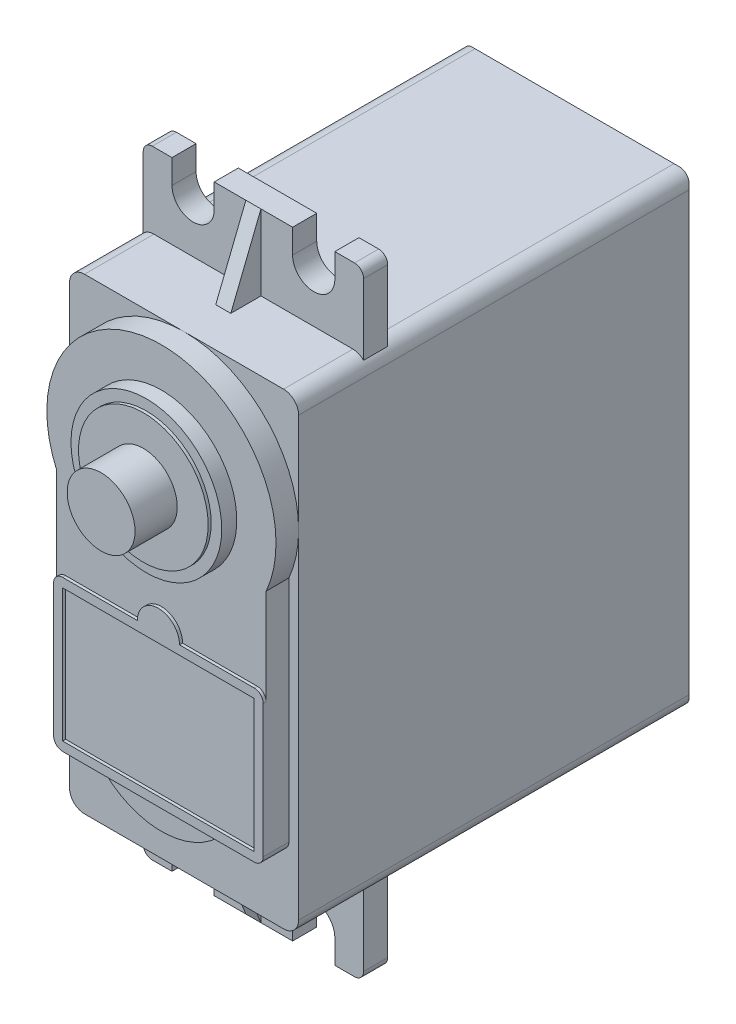
from build123d import *

# Parameters (mm, degrees)
SKETCH1_W            = 35.433
SKETCH1_H            = 39.37
BOSS_EXTRUDE1_DEPTH  = 9.652
BOSS_EXTRUDE2_DEPTH  = 1.905
SKETCH3_R            = 6.35
BOSS_EXTRUDE3_DEPTH  = 1.27
SKETCH4_R            = 5.461
BOSS_EXTRUDE4_DEPTH  = 0.254
SKETCH6_R            = 2.8575
BOSS_EXTRUDE5_DEPTH  = 3.556
FILLET1_R            = 0.762
BOSS_EXTRUDE6_START  = 0.254
SKETCH7_W            = 16.129
SKETCH7_H            = 11.176
BOSS_EXTRUDE6_DEPTH  = 0.254
CHAMFER1_SIZE        = 2.54
FILLET3_R            = 1.27
FILLET4_R            = 1.27
CUT_EXTRUDE1_DEPTH   = 2.032
MIRROR2_COPY_1_DEPTH = 2.032
BOSS_EXTRUDE7_DEPTH  = 2.032
BOSS_EXTRUDE8_DEPTH  = 0.635


with BuildPart() as part:
    # Sketch1 → Boss-Extrude1 (new, symmetric)
    with BuildSketch(Plane(origin=(0, 0, 0), x_dir=(0, 0, -1), z_dir=(1, 0, 0))):
        Rectangle(SKETCH1_W, SKETCH1_H)
    extrude(amount=BOSS_EXTRUDE1_DEPTH, both=True)

    # Sketch2 → Boss-Extrude2 (add)
    with BuildSketch(Plane.XY.offset(17.7165)):
        with BuildLine():
            Line((-8.8265, 6.127362824), (-8.8265, -13.8938))
            Line((-8.8265, -13.8938), (-4.7625, -13.8938))
            ThreePointArc((-4.7625, -13.8938), (0, -15.817151304), (4.7625, -13.8938))
            Line((4.7625, -13.8938), (8.8265, -13.8938))
            Line((8.8265, -13.8938), (8.8265, 6.127362824))
            ThreePointArc((8.8265, 6.127362824), (0, 19.685), (-8.8265, 6.127362824))
        make_face()
    extrude(amount=BOSS_EXTRUDE2_DEPTH)

    # Sketch3 → Boss-Extrude3 (add)
    with BuildSketch(Plane.XY.offset(19.6215)):
        with Locations(Location((0, 10.033, 0), (0, 0, 180))):
            Circle(SKETCH3_R)
    extrude(amount=BOSS_EXTRUDE3_DEPTH)

    # Sketch4 → Boss-Extrude4 (add)
    with BuildSketch(Plane.XY.offset(20.8915)):
        with Locations((0, 10.033)):
            Circle(SKETCH4_R)
    extrude(amount=BOSS_EXTRUDE4_DEPTH)

    # Sketch6 → Boss-Extrude5 (add)
    with BuildSketch(Plane.XY.offset(21.1455)):
        with Locations((0, 10.033)):
            Circle(SKETCH6_R)
    extrude(amount=BOSS_EXTRUDE5_DEPTH)

    # Fillet1
    fillet1_edges = [part.edges().sort_by_distance(p)[0] for p in [
        (-8.8265, -13.8938, 18.669),
        (8.8265, -13.8938, 18.669),
    ]]
    fillet(fillet1_edges, radius=FILLET1_R)

    # Sketch7 → Boss-Extrude6 (add)
    with BuildSketch(Plane.XY.offset(19.6215).offset(BOSS_EXTRUDE6_START)):
        with BuildLine():
            Line((8.8265, -13.1318), (8.8265, -1.9558))
            ThreePointArc((8.8265, -1.9558), (8.603315367, -1.416984633), (8.0645, -1.1938))
            Line((8.0645, -1.1938), (1.778, -1.1938))
            ThreePointArc((1.778, -1.1938), (0, 0.5842), (-1.778, -1.1938))
            Line((-1.778, -1.1938), (-8.0645, -1.1938))
            ThreePointArc((-8.0645, -1.1938), (-8.603315367, -1.416984633), (-8.8265, -1.9558))
            Line((-8.8265, -1.9558), (-8.8265, -13.1318))
            ThreePointArc((-8.8265, -13.1318), (-8.603315367, -13.670615367), (-8.0645, -13.8938))
            Line((-8.0645, -13.8938), (8.0645, -13.8938))
            ThreePointArc((8.0645, -13.8938), (8.603315367, -13.670615367), (8.8265, -13.1318))
        make_face()
        with Locations((0, -7.5438)):
            Rectangle(SKETCH7_W, SKETCH7_H, mode=Mode.SUBTRACT)
    extrude(amount=-BOSS_EXTRUDE6_DEPTH)

    # Chamfer1
    chamfer1_edges = [part.edges().sort_by_distance(p)[0] for p in [
        (9.652, 0, -17.7165),
        (-9.652, 0, -17.7165),
        (0, 19.685, -17.7165),
        (0, -19.685, -17.7165),
    ]]
    chamfer(chamfer1_edges, length=CHAMFER1_SIZE)

    # Fillet3
    # the kernel refuses this fillet: 1.27 mm, written as the material it takes off along each edge
    with BuildSketch(Plane(origin=(9.652, 19.685, -18.3515), x_dir=(0, -1, 0), z_dir=(0, 0, 1))) as fillet3_piece_1:
        with BuildLine():
            CenterArc((FILLET3_R, -FILLET3_R), FILLET3_R, 90, 90)
            Line((0, -FILLET3_R), (0, 0))
            Line((0, 0), (FILLET3_R, 0))
        make_face()
    extrude(amount=39.243, mode=Mode.SUBTRACT)
    with BuildSketch(Plane(origin=(10.710333333, 20.743333333, -14.118166667), x_dir=(0.408248290463863, -0.816496580927726, 0.408248290463863), z_dir=(-0.5773502691896258, -0.5773502691896257, -0.5773502691896257))) as fillet3_piece_2:
        with BuildLine():
            CenterArc((FILLET3_R * 0.57735026919, FILLET3_R), FILLET3_R, 210, 60)
            Line((-FILLET3_R * 0.288675134595, FILLET3_R * 0.5), (0, 0))
            Line((0, 0), (FILLET3_R * 0.57735026919, 0))
        make_face()
    extrude(amount=8.065583261, mode=Mode.SUBTRACT)

    # Fillet4
    # the kernel refuses this fillet: 1.27 mm, written as the material it takes off along each edge
    with BuildSketch(Plane(origin=(-9.652, 19.685, -18.3515), x_dir=(0, -1, 0), z_dir=(0, 0, 1))) as fillet4_piece_1:
        with BuildLine():
            CenterArc((FILLET4_R, FILLET4_R), FILLET4_R, 180, 90)
            Line((0, FILLET4_R), (0, 0))
            Line((0, 0), (FILLET4_R, 0))
        make_face()
    extrude(amount=39.243, mode=Mode.SUBTRACT)
    with BuildSketch(Plane(origin=(-6.053666667, 16.086666667, -18.774833333), x_dir=(0.816496580927726, 0.40824829046386296, 0.40824829046386296), z_dir=(-0.5773502691896257, 0.5773502691896258, 0.5773502691896258)), Plane(origin=(10.710333333, -20.743333333, -14.118166667), x_dir=(0.4082482904638618, 0.816496580927726, 0.40824829046386424), z_dir=(-0.5773502691896258, 0.5773502691896257, -0.5773502691896257))) as fillet4_piece_2:
        with BuildLine():
            CenterArc((FILLET4_R * 0.57735026919, -FILLET4_R), FILLET4_R, 90, 60)
            Line((-FILLET4_R * 0.288675134595, -FILLET4_R * 0.5), (0, 0))
            Line((0, 0), (FILLET4_R * 0.57735026919, 0))
        make_face()
    extrude(amount=8.065583261, mode=Mode.SUBTRACT)
    with BuildSketch(Plane(origin=(-6.053666667, -16.086666667, -18.774833333), x_dir=(0.8164965809277258, -0.4082482904638633, 0.4082482904638633), z_dir=(-0.5773502691896261, -0.5773502691896256, 0.5773502691896256))) as fillet4_piece_3:
        with BuildLine():
            CenterArc((FILLET4_R * 0.57735026919, FILLET4_R), FILLET4_R, 210, 60)
            Line((-FILLET4_R * 0.288675134595, FILLET4_R * 0.5), (0, 0))
            Line((0, 0), (FILLET4_R * 0.57735026919, 0))
        make_face()
    extrude(amount=8.065583261, mode=Mode.SUBTRACT)
    with BuildSketch(Plane(origin=(-9.652, -19.685, 20.8915), x_dir=(1, 0, 0), z_dir=(0, 0, -1)), Plane(origin=(9.652, -19.685, 20.8915), x_dir=(0, 1, 0), z_dir=(0, 0, -1))) as fillet4_piece_4:
        with BuildLine():
            CenterArc((FILLET4_R, -FILLET4_R), FILLET4_R, 90, 90)
            Line((0, -FILLET4_R), (0, 0))
            Line((0, 0), (FILLET4_R, 0))
        make_face()
    extrude(amount=39.243, mode=Mode.SUBTRACT)

    # Sketch9 → Cut-Extrude1 (cut)
    with BuildSketch(Plane(origin=(0, 0, -17.7165), x_dir=(-1, 0, 0), z_dir=(0, 0, -1))):
        with BuildLine():
            Line((-5.181767112, 17.145), (-5.181767112, 19.685))
            Line((-5.181767112, 19.685), (-9.652, 19.685))
            Line((-9.652, 19.685), (-9.652, 15.748))
            Line((-9.652, 15.748), (-7.112, 15.748))
            ThreePointArc((-7.112, 15.748), (-5.920634397, 16.133891863), (-5.181767112, 17.145))
        make_face()
    cut_extrude1 = extrude(amount=-CUT_EXTRUDE1_DEPTH, mode=Mode.SUBTRACT)

    # Mirror1: Cut-Extrude1 across plane
    add(cut_extrude1.mirror(Plane.ZX), mode=Mode.SUBTRACT)

    # Mirror2: Cut-Extrude1 across plane
    add(cut_extrude1.mirror(Plane(origin=(0, 0, 0), x_dir=(0, 0, 1), z_dir=(1, 0, 0))), mode=Mode.SUBTRACT)

    # Mirror2 copy 1 sketch → Mirror2 copy 1 (cut)
    with BuildSketch(Plane(origin=(0, 0, -17.7165), x_dir=(1, 0, 0), z_dir=(0, 0, -1))):
        with BuildLine():
            Line((-5.181767112, 17.145), (-5.181767112, 19.685))
            Line((-5.181767112, 19.685), (-9.652, 19.685))
            Line((-9.652, 19.685), (-9.652, 15.748))
            Line((-9.652, 15.748), (-7.112, 15.748))
            ThreePointArc((-7.112, 15.748), (-5.920634397, 16.133891863), (-5.181767112, 17.145))
        make_face()
    extrude(amount=-MIRROR2_COPY_1_DEPTH, mode=Mode.SUBTRACT)

    # Sketch13 → Boss-Extrude7 (add)
    with BuildSketch(Plane.XY.offset(11.8745)):
        with BuildLine():
            Line((-9.280025612, -19.313025612), (-9.280025612, -25.273))
            ThreePointArc((-9.280025612, -25.273), (-9.056840979, -25.811815367), (-8.518025612, -26.035))
            Line((-8.518025612, -26.035), (-6.858, -26.035))
            Line((-6.858, -26.035), (-6.858, -24))
            ThreePointArc((-6.858, -24), (-5.08, -22.222), (-3.302, -24))
            Line((-3.302, -24), (-3.302, -26.035))
            Line((-3.302, -26.035), (3.302, -26.035))
            Line((3.302, -26.035), (3.302, -24))
            ThreePointArc((3.302, -24), (5.08, -22.222), (6.858, -24))
            Line((6.858, -24), (6.858, -26.035))
            Line((6.858, -26.035), (8.518025612, -26.035))
            ThreePointArc((8.518025612, -26.035), (9.056840979, -25.811815367), (9.280025612, -25.273))
            Line((9.280025612, -25.273), (9.280025612, -19.313025612))
            ThreePointArc((9.280025612, -19.313025612), (8.868007959, -19.588327006), (8.382, -19.685))
            Line((8.382, -19.685), (-8.382, -19.685))
            ThreePointArc((-8.382, -19.685), (-8.868007959, -19.588327006), (-9.280025612, -19.313025612))
        make_face()
    boss_extrude7 = extrude(amount=-BOSS_EXTRUDE7_DEPTH)

    # Sketch14 → Boss-Extrude8 (add, symmetric)
    with BuildSketch(Plane(origin=(0, 0, 0), x_dir=(0, 0, -1), z_dir=(1, 0, 0))):
        Polygon((-11.8745, -26.035), (-14.4145, -19.685), (-11.8745, -19.685), align=None)
    boss_extrude8 = extrude(amount=BOSS_EXTRUDE8_DEPTH, both=True)

    # Mirror3: Boss-Extrude7, Boss-Extrude8 across plane
    add(boss_extrude7.mirror(Plane.ZX))
    add(boss_extrude8.mirror(Plane.ZX))


solid = part.part
